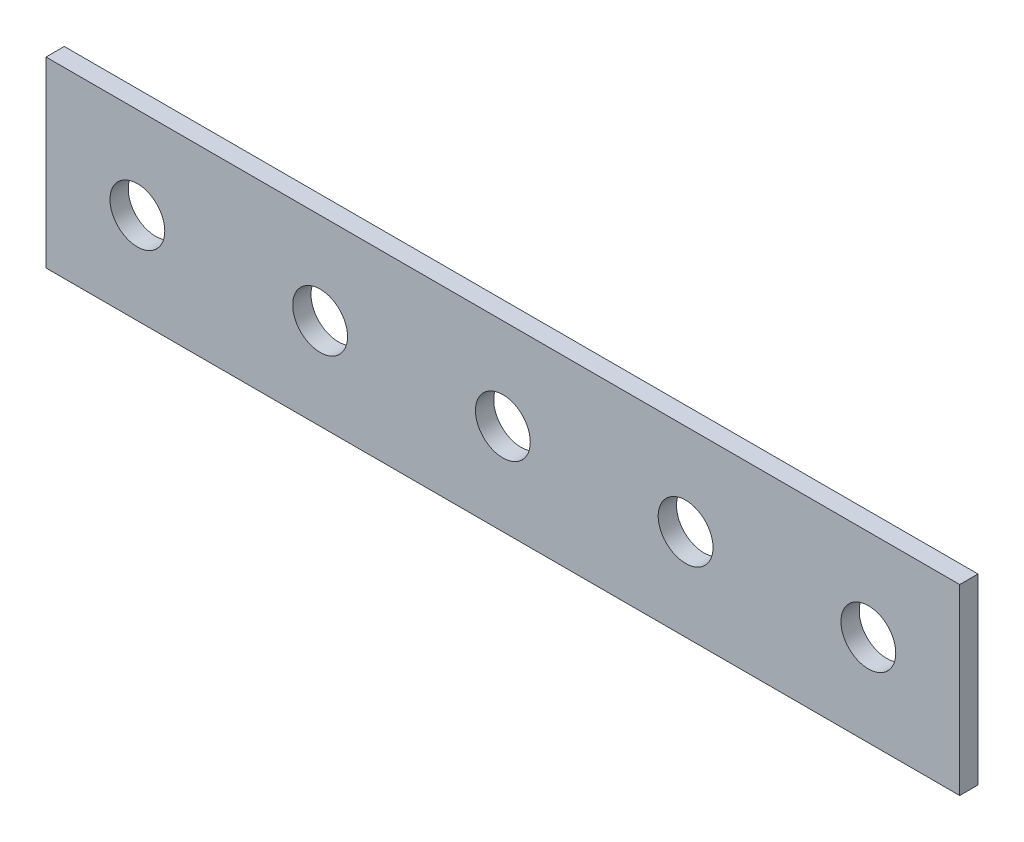
from build123d import *

# Parameters (mm, degrees)
ESQUISSE1_W                = 50
ESQUISSE1_H                = 10
BOSS_EXTRU_1_DEPTH         = 1
ESQUISSE2_R                = 1.5
ENL_V_MAT_EXTRU_1_DEPTH    = 52
R_P_TITION_LIN_AIRE1_COUNT = 3
R_P_TITION_LIN_AIRE1_PITCH = 10
R_P_TITION_LIN_AIRE2_COUNT = 3
R_P_TITION_LIN_AIRE2_PITCH = 10


with BuildPart() as part:
    # Esquisse1 → Boss.-Extru.1 (new body)
    with BuildSketch(Plane.XY):
        with Locations((25, 5)):
            Rectangle(ESQUISSE1_W, ESQUISSE1_H)
    extrude(amount=BOSS_EXTRU_1_DEPTH)

    # Esquisse2 → Enlèv. mat.-Extru.1 (cut, through all)
    with BuildSketch(Plane.XY.offset(1)):
        with Locations((25, 5)):
            Circle(ESQUISSE2_R)
    enl_v_mat_extru_1 = extrude(amount=-ENL_V_MAT_EXTRU_1_DEPTH, mode=Mode.SUBTRACT)

    # Répétition linéaire1: Enlèv. mat.-Extru.1 ×3
    with Locations(*[(i * R_P_TITION_LIN_AIRE1_PITCH, 0, 0) for i in range(1, R_P_TITION_LIN_AIRE1_COUNT)]):
        add(enl_v_mat_extru_1, mode=Mode.SUBTRACT)

    # Répétition linéaire2: Enlèv. mat.-Extru.1 ×3
    with Locations(*[(-i * R_P_TITION_LIN_AIRE2_PITCH, 0, 0) for i in range(1, R_P_TITION_LIN_AIRE2_COUNT)]):
        add(enl_v_mat_extru_1, mode=Mode.SUBTRACT)


solid = part.part
